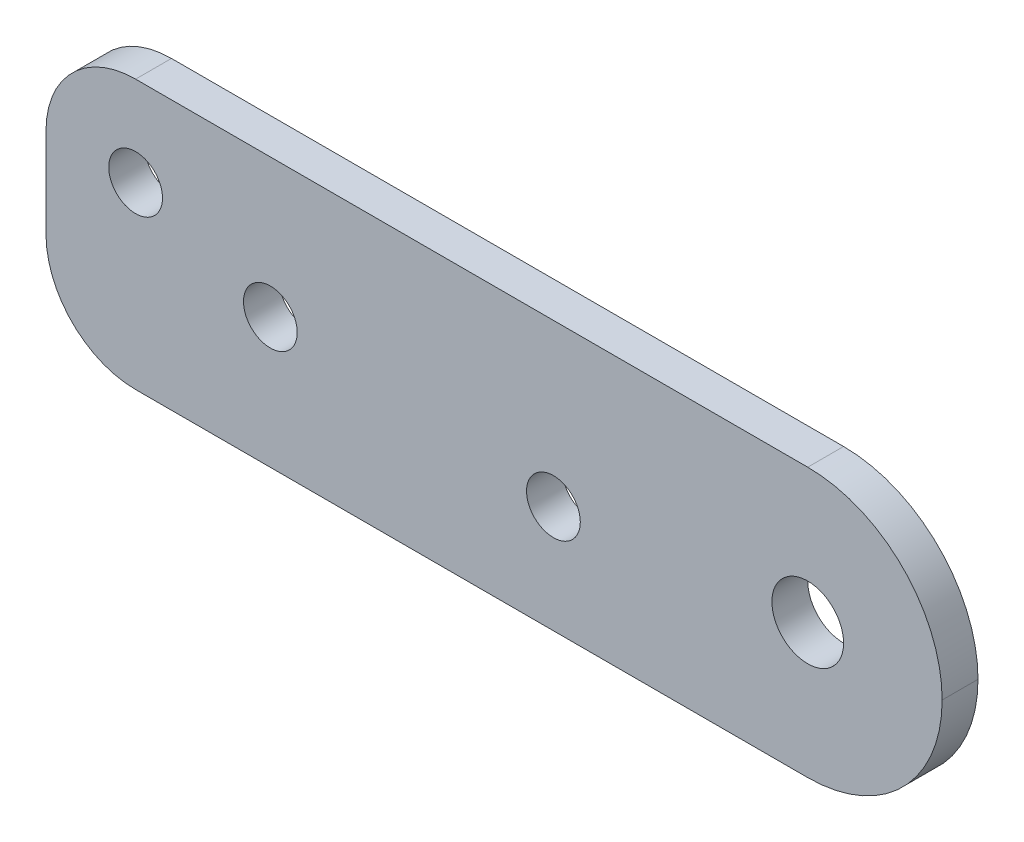
from build123d import *

# Parameters (mm, degrees)
SKETCH_1_W          = 50
SKETCH_1_H          = 15
EXTRUDE_1_DEPTH     = 2
FILLET_1_R          = 5
FILLET_2_R          = 7.5
SKETCH_3_R          = 1.5
SKETCH_3_R_2        = 2
CUT_EXTRUDE_1_DEPTH = 2
SKETCH_4_R          = 1.5
CUT_EXTRUDE_2_DEPTH = 10


with BuildPart() as part:
    # 草图1 → 凸台-拉伸1 (new body)
    with BuildSketch(Plane.XY):
        Rectangle(SKETCH_1_W, SKETCH_1_H)
    extrude(amount=EXTRUDE_1_DEPTH)

    # 圆角1
    fillet_1_edges = [part.edges().sort_by_distance(p)[0] for p in [
        (-25, -7.5, 1),
        (-25, 7.5, 1),
    ]]
    fillet(fillet_1_edges, radius=FILLET_1_R)

    # 圆角2
    fillet_2_edges = [part.edges().sort_by_distance(p)[0] for p in [
        (25, -7.5, 1),
        (25, 7.5, 1),
    ]]
    fillet(fillet_2_edges, radius=FILLET_2_R - 0.0001)  # a hair under: the kernel refuses the full size

    # 草图3 → 切除-拉伸1 (cut)
    with BuildSketch(Plane.XY.offset(2)):
        with Locations((-20, 2.5)):
            Circle(SKETCH_3_R)
        with Locations((-12.482459034, -0.236161147)):
            Circle(SKETCH_3_R)
        with Locations((17.5, 0)):
            Circle(SKETCH_3_R_2)
    extrude(amount=-CUT_EXTRUDE_1_DEPTH, mode=Mode.SUBTRACT)

    # 草图4 → 切除-拉伸2 (cut)
    with BuildSketch(Plane.XY.offset(2)):
        with Locations((3.310591225, -1.5)):
            Circle(SKETCH_4_R)
    extrude(amount=-CUT_EXTRUDE_2_DEPTH, mode=Mode.SUBTRACT)


solid = part.part
